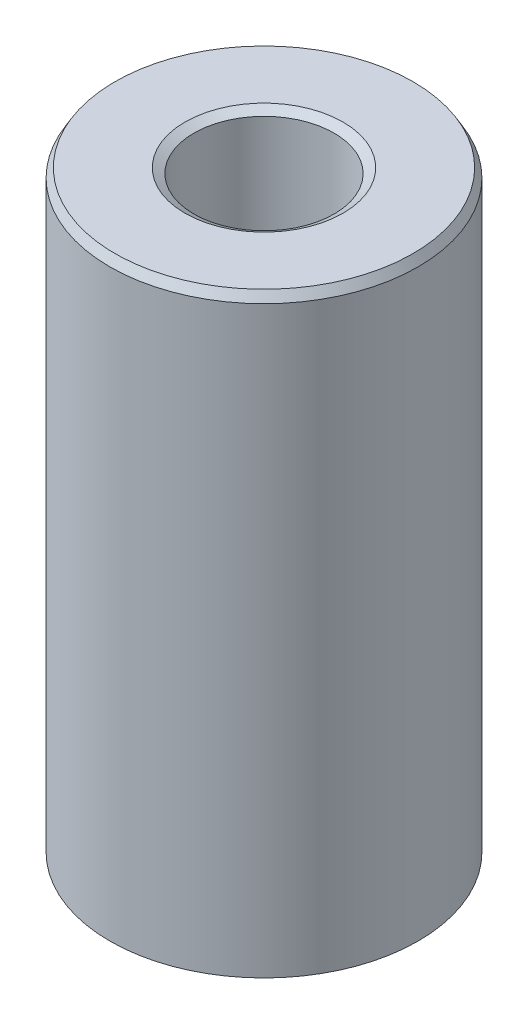
from build123d import *
from OCP.BRepFilletAPI import BRepFilletAPI_MakeChamfer

# Parameters (mm, degrees)
SKETCH1_R           = 60
BOSS_EXTRUDE1_DEPTH = 232.81361272
SKETCH2_R           = 27.300843447
CUT_EXTRUDE1_DEPTH  = 248.794629215
CHAMFER1_SIZE       = 3.464760979
CHAMFER1_SIZE2      = 2.000380684


with BuildPart() as part:
    # Sketch1 → Boss-Extrude1 (new body)
    with BuildSketch(Plane(origin=(0, 0, 0), x_dir=(1, 0, 0), z_dir=(0, 1, 0))):
        Circle(SKETCH1_R)
    extrude(amount=BOSS_EXTRUDE1_DEPTH)

    # Sketch2 → Cut-Extrude1 (cut, through all)
    with BuildSketch(Plane(origin=(0, 0, 0), x_dir=(1, 0, 0), z_dir=(0, 1, 0))):
        Circle(SKETCH2_R)
    extrude(amount=CUT_EXTRUDE1_DEPTH, mode=Mode.SUBTRACT)

    # Chamfer1: one chamfer whose edges measure the first distance from different faces: ONE call of the kernel's chamfer builder (chamfer() names one face for all edges)
    chamfer1_edges_1 = [part.edges().sort_by_distance(p)[0] for p in [
        (-27.300843447, 232.81361272, 0),
    ]]
    chamfer1_side_1 = [part.faces().sort_by_distance(p)[0] for p in [
        (-58.302943725, 232.81361272, 0),
    ]]
    chamfer1_edges_2 = [part.edges().sort_by_distance(p)[0] for p in [
        (-27.300843447, 0, 0),
    ]]
    chamfer1_side_2 = [part.faces().sort_by_distance(p)[0] for p in [
        (-27.300843447, 116.40680636, 0),
    ]]
    chamfer1_edges_3 = [part.edges().sort_by_distance(p)[0] for p in [
        (-60, 0, 0),
    ]]
    chamfer1_side_3 = [part.faces().sort_by_distance(p)[0] for p in [
        (-58.302943725, 0, 0),
    ]]
    chamfer1_edges_4 = [part.edges().sort_by_distance(p)[0] for p in [
        (-60, 232.81361272, 0),
    ]]
    chamfer1_side_4 = [part.faces().sort_by_distance(p)[0] for p in [
        (-60, 116.40680636, 0),
    ]]
    chamfer1 = BRepFilletAPI_MakeChamfer(part.part.solid().wrapped)
    for e in chamfer1_edges_1:
        chamfer1.Add(CHAMFER1_SIZE, CHAMFER1_SIZE2, e.wrapped, chamfer1_side_1[0].wrapped)  # the first distance lies on this face
    for e in chamfer1_edges_2:
        chamfer1.Add(CHAMFER1_SIZE, CHAMFER1_SIZE2, e.wrapped, chamfer1_side_2[0].wrapped)  # the first distance lies on this face
    for e in chamfer1_edges_3:
        chamfer1.Add(CHAMFER1_SIZE, CHAMFER1_SIZE2, e.wrapped, chamfer1_side_3[0].wrapped)  # the first distance lies on this face
    for e in chamfer1_edges_4:
        chamfer1.Add(CHAMFER1_SIZE, CHAMFER1_SIZE2, e.wrapped, chamfer1_side_4[0].wrapped)  # the first distance lies on this face
    add(Compound.cast(chamfer1.Shape()), mode=Mode.REPLACE)


solid = part.part
